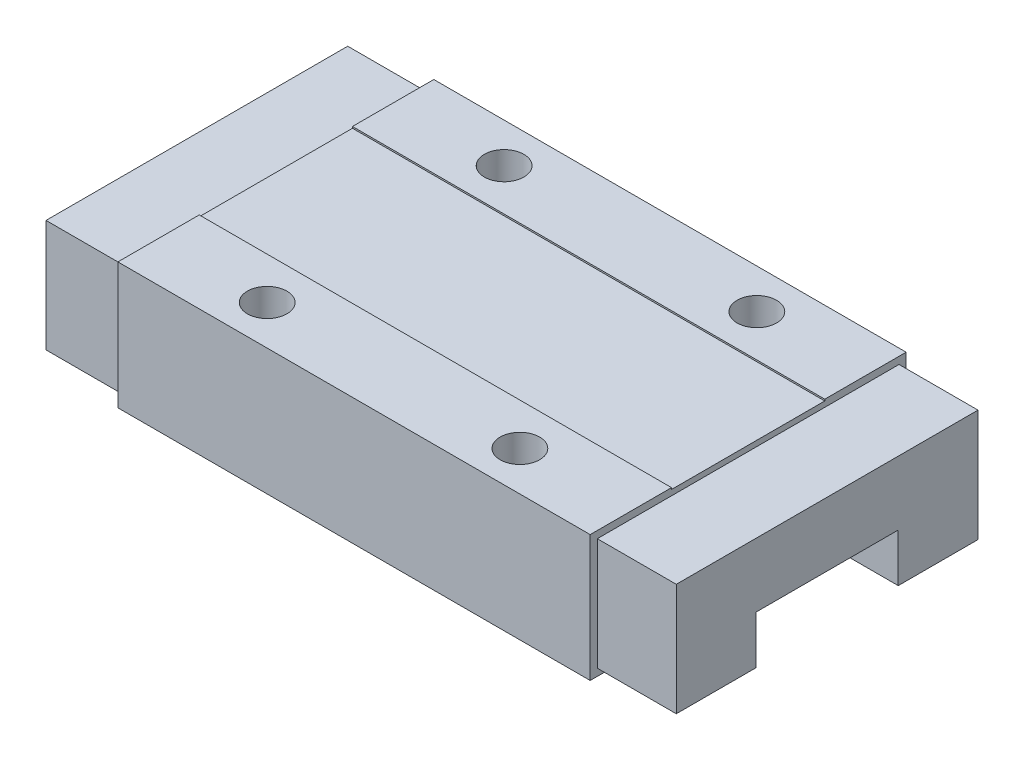
from build123d import *

# Parameters (mm, degrees)
SKETCH_1_W          = 20
SKETCH_1_H          = 8
EXTRUDE_1_DEPTH     = 14.95
SKETCH_2_W          = 9.7
SKETCH_2_H          = 0.2
CUT_EXTRUDE_1_DEPTH = 14.95
SKETCH_3_W          = 19.1
SKETCH_3_H          = 7.1
EXTRUDE_2_DEPTH     = 19.95
SKETCH_4_W          = 9
SKETCH_4_H          = 3.5
CUT_EXTRUDE_2_DEPTH = 19.95
SKETCH_5_R          = 1.25
CUT_EXTRUDE_3_DEPTH = 3


with BuildPart() as part:
    # 草图1 → 凸台-拉伸1 (new, symmetric)
    with BuildSketch(Plane(origin=(0, 0, 0), x_dir=(0, 0, -1), z_dir=(1, 0, 0))):
        Rectangle(SKETCH_1_W, SKETCH_1_H)
    extrude(amount=EXTRUDE_1_DEPTH, both=True)

    # 草图2 → 切除-拉伸1 (cut, symmetric)
    with BuildSketch(Plane(origin=(0, 0, 0), x_dir=(0, 0, -1), z_dir=(1, 0, 0))):
        with Locations((0, 4)):
            Rectangle(SKETCH_2_W, SKETCH_2_H)
    extrude(amount=CUT_EXTRUDE_1_DEPTH, both=True, mode=Mode.SUBTRACT)

    # 草图3 → 凸台-拉伸2 (add, symmetric)
    with BuildSketch(Plane(origin=(0, 0, 0), x_dir=(0, 0, -1), z_dir=(1, 0, 0))):
        Rectangle(SKETCH_3_W, SKETCH_3_H)
    extrude(amount=EXTRUDE_2_DEPTH, both=True)

    # 草图4 → 切除-拉伸2 (cut, symmetric)
    with BuildSketch(Plane(origin=(0, 0, 0), x_dir=(0, 0, -1), z_dir=(1, 0, 0))):
        with Locations((0, -2.25)):
            Rectangle(SKETCH_4_W, SKETCH_4_H)
    extrude(amount=CUT_EXTRUDE_2_DEPTH, both=True, mode=Mode.SUBTRACT)

    # 草图5 → 切除-拉伸3 (cut)
    with BuildSketch(Plane(origin=(0, 4, 0), x_dir=(1, 0, 0), z_dir=(0, 1, 0))):
        with Locations((-8, 7.5)):
            Circle(SKETCH_5_R)
        with Locations((8, 7.5)):
            Circle(SKETCH_5_R)
        with Locations((8, -7.5)):
            Circle(SKETCH_5_R)
        with Locations((-8, -7.5)):
            Circle(SKETCH_5_R)
    extrude(amount=-CUT_EXTRUDE_3_DEPTH, mode=Mode.SUBTRACT)


solid = part.part
